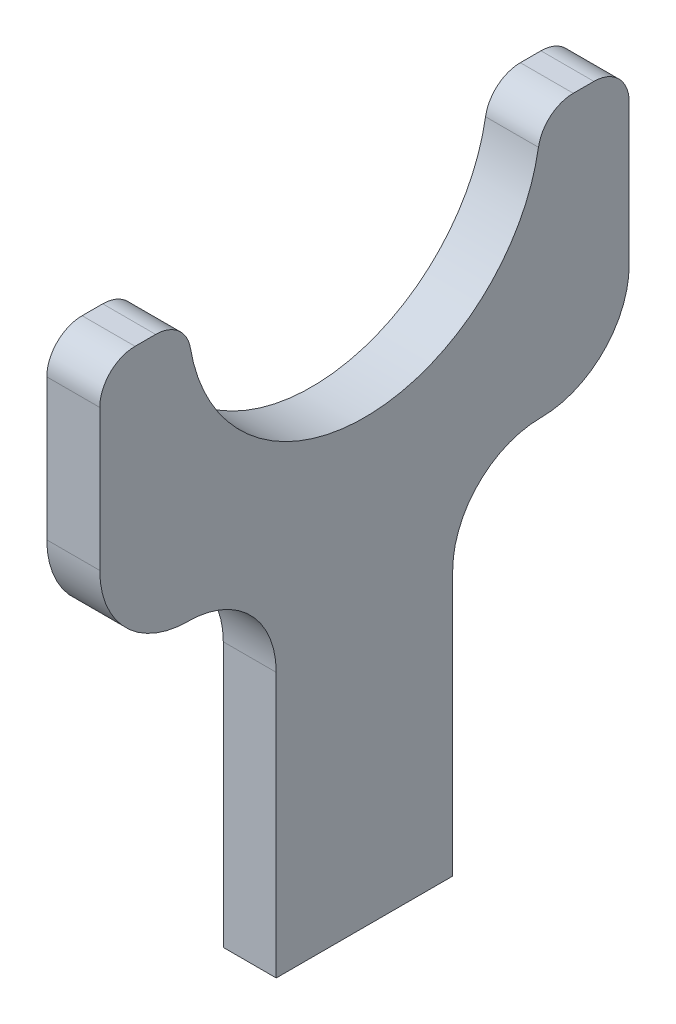
from build123d import *

# Parameters (mm, degrees)
SKETCH1_W           = 30
SKETCH1_H           = 35
BOSS_EXTRUDE1_DEPTH = 3
SKETCH2_W           = 10
SKETCH2_H           = 20
CUT_EXTRUDE1_DEPTH  = 3
SKETCH5_R           = 10
CUT_EXTRUDE2_DEPTH  = 3
FILLET1_DEPTH       = 3
FILLET1_2_DEPTH     = 3
FILLET2_R           = 2


with BuildPart() as part:
    # Sketch1 → Boss-Extrude1 (new body)
    with BuildSketch(Plane(origin=(0, 0, 0), x_dir=(0, 0, -1), z_dir=(1, 0, 0))):
        with Locations((15, 17.5)):
            Rectangle(SKETCH1_W, SKETCH1_H)
    extrude(amount=BOSS_EXTRUDE1_DEPTH)

    # Sketch2 → Cut-Extrude1 (cut)
    with BuildSketch(Plane(origin=(3, 0, 0), x_dir=(0, 0, -1), z_dir=(1, 0, 0))):
        with Locations((5, 10)):
            Rectangle(SKETCH2_W, SKETCH2_H)
        with Locations((25, 10)):
            Rectangle(SKETCH2_W, SKETCH2_H)
    extrude(amount=-CUT_EXTRUDE1_DEPTH, mode=Mode.SUBTRACT)

    # Sketch5 → Cut-Extrude2 (cut)
    with BuildSketch(Plane(origin=(3, 0, 0), x_dir=(0, 0, -1), z_dir=(1, 0, 0))):
        with Locations((15, 35)):
            Circle(SKETCH5_R)
    extrude(amount=-CUT_EXTRUDE2_DEPTH, mode=Mode.SUBTRACT)

    # Fillet1: read off the stored shape, not the designer's step
    # Fillet1 outline → Fillet1 (cut)
    with BuildSketch(Plane.YZ):
        with BuildLine():
            ThreePointArc((25, -30), (21.464466094, -28.535533906), (20, -25))
            Line((20, -25), (20, -30))
            Line((20, -30), (25, -30))
        make_face()
        with BuildLine():
            Line((20, 0), (20, -5))
            ThreePointArc((20, -5), (21.464466094, -1.464466094), (25, 0))
            Line((25, 0), (20, 0))
        make_face()
    extrude(amount=FILLET1_DEPTH, mode=Mode.SUBTRACT)

    # Fillet1 2 outline → Fillet1 2 (add)
    with BuildSketch(Plane.YZ):
        with BuildLine():
            Line((20, -20), (15, -20))
            ThreePointArc((15, -20), (18.535533906, -21.464466094), (20, -25))
            Line((20, -25), (20, -20))
        make_face()
        with BuildLine():
            Line((20, -10), (20, -5))
            ThreePointArc((20, -5), (18.535533906, -8.535533906), (15, -10))
            Line((15, -10), (20, -10))
        make_face()
    extrude(amount=FILLET1_2_DEPTH)

    # Fillet2
    fillet2_edges = [part.edges().sort_by_distance(p)[0] for p in [
        (1.5, 35, -25),
        (1.5, 35, -5),
        (1.5, 35, 0),
        (1.5, 35, -30),
    ]]
    fillet(fillet2_edges, radius=FILLET2_R)


solid = part.part
